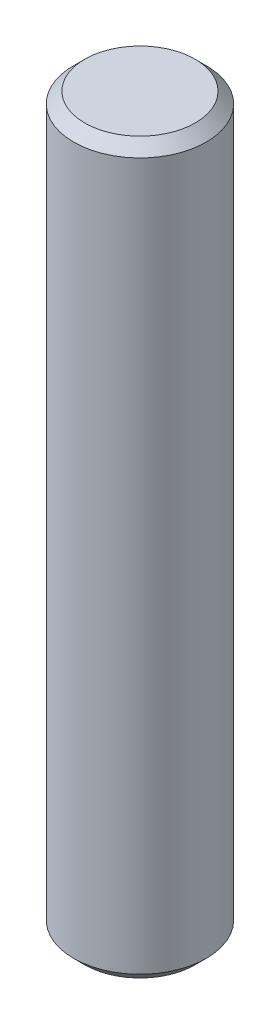
from build123d import *

# Parameters (mm, degrees)
SZKIC1_R                    = 3
DODANIE_WYCI_GNI_CIE1_DEPTH = 33
SFAZOWANIE1_SIZE            = 0.5


with BuildPart() as part:
    # Szkic1 → Dodanie-wyciągnięcie1 (new body)
    with BuildSketch(Plane(origin=(0, 0, 0), x_dir=(1, 0, 0), z_dir=(0, 1, 0))):
        Circle(SZKIC1_R)
    extrude(amount=DODANIE_WYCI_GNI_CIE1_DEPTH)

    # Sfazowanie1
    sfazowanie1_edges = [part.edges().sort_by_distance(p)[0] for p in [
        (-3, 0, 0),
        (-3, 33, 0),
    ]]
    chamfer(sfazowanie1_edges, length=SFAZOWANIE1_SIZE)


solid = part.part
